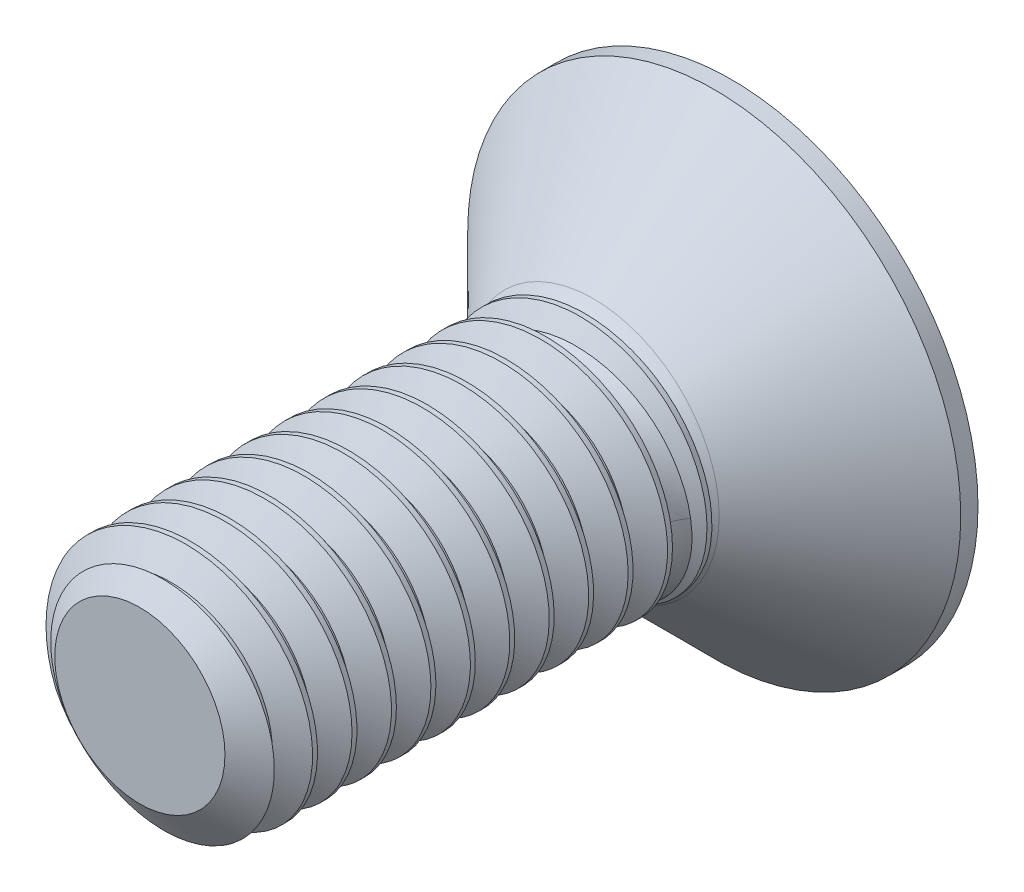
from build123d import *

# Parameters (mm, degrees)
SKETCH1_R          = 2.5
EXTRUDE1_DEPTH     = 12
CUT_SWEEP1_PITCH   = 0.8
SKETCH6_R          = 5
EXTRUDE2_DEPTH     = 2.8
CUT_EXTRUDE1_DEPTH = 2.25
SKETCH8_R          = 1.732050808
CUT_EXTRUDE2_DEPTH = 14.928388363
CUT_EXTRUDE2_TAPER = 45


with BuildPart() as part:
    # Sketch1 → Extrude1 (new body)
    with BuildSketch(Plane.XY):
        Circle(SKETCH1_R)
    extrude(amount=-EXTRUDE1_DEPTH)

    # Cut-Sweep1: the profile of Sketch3 profile screwed along a right-hand helix of 16 turns, 6 arcs to a turn; built about Z, then put on its axis
    cut_sweep1_z = Axis((0, 0, 0), (0, 0, 1))
    cut_sweep1_corners = [(2.5003, 0, -0.700173205), (1.980384758, 0, -0.4), (1.980384758, 0, -0.3), (2.5003, 0, 0.000173205)]
    with BuildLine(mode=Mode.PRIVATE) as cut_sweep1_profile:
        Line(cut_sweep1_corners[0], cut_sweep1_corners[1])
        Line(cut_sweep1_corners[1], cut_sweep1_corners[2])
        Line(cut_sweep1_corners[2], cut_sweep1_corners[3])
        Line(cut_sweep1_corners[3], cut_sweep1_corners[0])
    cut_sweep1_cap = Face(cut_sweep1_profile.wire())
    cut_sweep1_turn_angles = [0, 30, 60, 90, 120, 150, 180, 210, 240, 270, 300, 330, 360]
    cut_sweep1_turn_weights = [1, 0.8660254037844387, 1, 0.8660254037844387, 1, 0.8660254037844387, 1, 0.8660254037844387, 1, 0.8660254037844387, 1, 0.8660254037844387, 1]
    cut_sweep1_turn_rails = [Edge.make_bspline([Vector(p[0], p[1], 0).rotate(cut_sweep1_z, cut_sweep1_turn_angles[k]) / cut_sweep1_turn_weights[k] + Vector(0, 0, p[2] + CUT_SWEEP1_PITCH * cut_sweep1_turn_angles[k] / 360) for k in range(13)], [0, 0, 0, 1, 1, 2, 2, 3, 3, 4, 4, 5, 5, 6, 6, 6], 2, cut_sweep1_turn_weights) for p in cut_sweep1_corners]
    cut_sweep1_turn_sides = [Face.make_surface_from_curves(cut_sweep1_turn_rails[p[0]], cut_sweep1_turn_rails[p[1]]) for p in [(0, 1), (1, 2), (2, 3), (3, 0)]]
    cut_sweep1 = Plane(origin=(0, 0, 0), x_dir=(0, 1, 0), z_dir=(0, 0, -1)) * Solid(Shell([*[p.moved(Location((0, 0, CUT_SWEEP1_PITCH * i))) for i in range(16) for p in cut_sweep1_turn_sides], cut_sweep1_cap, cut_sweep1_cap.rotate(cut_sweep1_z, 5760).moved(Location((0, 0, CUT_SWEEP1_PITCH * 5760 / 360)))]))
    add(cut_sweep1, mode=Mode.SUBTRACT)

    # Sketch4 → Cut-Revolve1 (revolve, cut)
    with BuildSketch(Plane(origin=(0, 0, 0), x_dir=(0, 0, -1), z_dir=(1, 0, 0)), mode=Mode.PRIVATE) as cut_revolve1_sk:
        Polygon((0.541691224, 2.5), (0, 1.726384758), (0, 2.5), align=None)
    revolve(cut_revolve1_sk.sketch.rotate(Axis((0, 0, 0), (0, 0, -1)), 260.43858876), axis=Axis((0, 0, 0), (0, 0, -1)), mode=Mode.SUBTRACT)

    # Sketch6 → Extrude2 (add)
    with BuildSketch(Plane(origin=(0, 0, -12), x_dir=(-1, 0, 0), z_dir=(0, 0, -1))):
        Circle(SKETCH6_R)
    extrude(amount=-EXTRUDE2_DEPTH)

    # Sketch10 → Cut-Revolve2 (revolve, cut)
    with BuildSketch(Plane(origin=(0, 0, 0), x_dir=(0, 0, -1), z_dir=(1, 0, 0)), mode=Mode.PRIVATE) as cut_revolve2_sk:
        Polygon((11.65, -5), (9.2, -2.55), (9.2, -5), align=None)
    revolve(cut_revolve2_sk.sketch.rotate(Axis((0, 0, 0), (0, 0, -1)), 270), axis=Axis((0, 0, 0), (0, 0, -1)), mode=Mode.SUBTRACT)

    # Sketch11 → Revolve1 (revolve)
    with BuildSketch(Plane(origin=(0, 0, 0), x_dir=(0, 0, -1), z_dir=(1, 0, 0)), mode=Mode.PRIVATE) as revolve1_sk:
        with BuildLine():
            Line((7.824827157, 1.980384758), (7.824827157, 0))
            Line((7.824827157, 0), (9.2, 0))
            Line((9.2, 0), (9.2, 2.55))
            ThreePointArc((9.2, 2.55), (8.569065337, 2.128422936), (7.824827157, 1.980384758))
        make_face()
    revolve(revolve1_sk.sketch.rotate(Axis((0, 0, 0), (0, 0, -1)), 90), axis=Axis((0, 0, 0), (0, 0, -1)))

    # Sketch7 → Cut-Extrude1 (cut)
    with BuildSketch(Plane.XY.offset(-12)):
        Polygon((0, 1.732050808), (-1.5, 0.866025404), (-1.5, -0.866025404), (0, -1.732050808), (1.5, -0.866025404), (1.5, 0.866025404), align=None)
    extrude(amount=CUT_EXTRUDE1_DEPTH, mode=Mode.SUBTRACT)

    # Sketch8 → Cut-Extrude2 (cut, through all)
    with BuildSketch(Plane.XY.offset(-12)):
        Circle(SKETCH8_R)
    extrude(amount=CUT_EXTRUDE2_DEPTH, taper=CUT_EXTRUDE2_TAPER, mode=Mode.SUBTRACT)


solid = part.part
